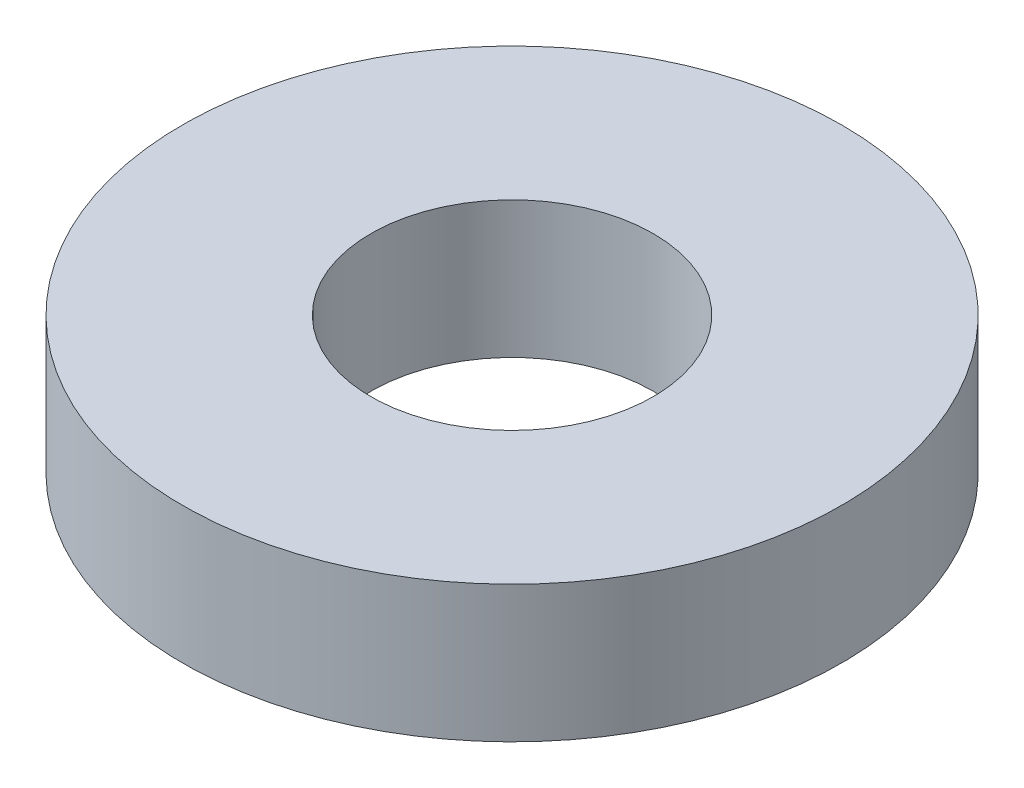
from build123d import *

# Parameters (mm, degrees)
SKETCH1_R           = 70
BOSS_EXTRUDE1_DEPTH = 29
SKETCH2_R           = 30
CUT_EXTRUDE1_DEPTH  = 104.155222844


with BuildPart() as part:
    # Sketch1 → Boss-Extrude1 (new body)
    with BuildSketch(Plane(origin=(0, 0, 0), x_dir=(1, 0, 0), z_dir=(0, 1, 0))):
        Circle(SKETCH1_R)
    extrude(amount=BOSS_EXTRUDE1_DEPTH)

    # Sketch2 → Cut-Extrude1 (cut, through all)
    with BuildSketch(Plane(origin=(0, 0, 0), x_dir=(1, 0, 0), z_dir=(0, 1, 0))):
        Circle(SKETCH2_R)
    extrude(amount=CUT_EXTRUDE1_DEPTH, mode=Mode.SUBTRACT)


solid = part.part
